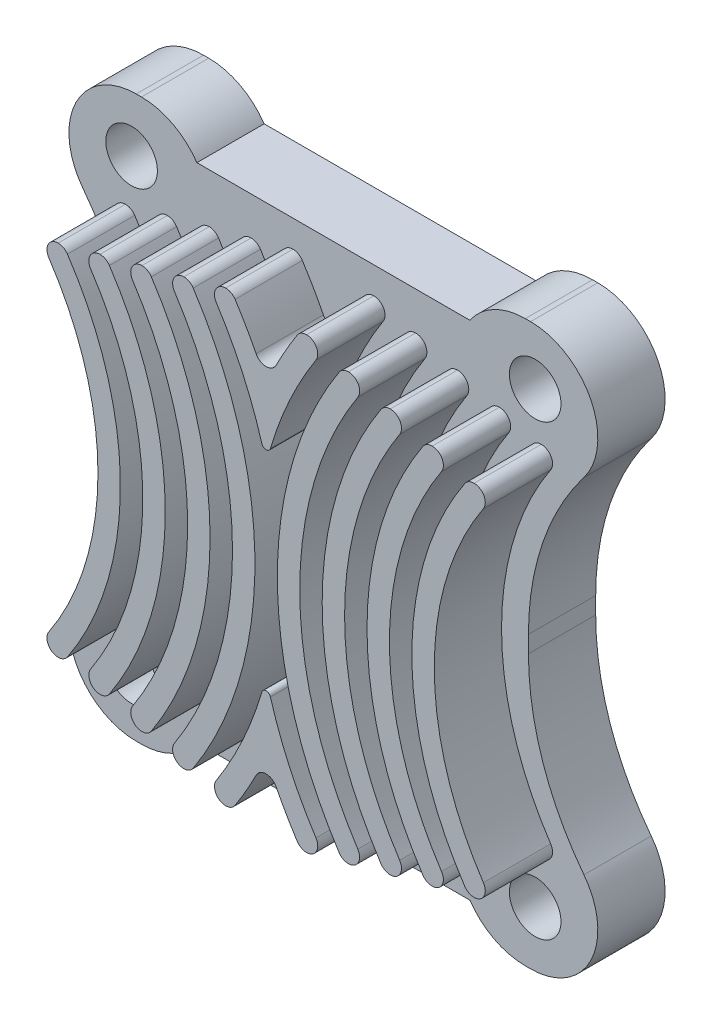
from build123d import *

# Parameters (mm, degrees)
ESQUISSE1_R             = 3.15
ESQUISSE1_R_2           = 1.15
ESQUISSE1_W             = 13.4
ESQUISSE1_H             = 12.4
BOSS_EXTRU_1_DEPTH      = 3
ESQUISSE2_W             = 14
ESQUISSE2_H             = 13
ENL_V_MAT_EXTRU_1_DEPTH = 2
CONG_1_R                = 12
ESQUISSE3_W             = 25
ESQUISSE3_H             = 2
ENL_V_MAT_EXTRU_2_DEPTH = 19.153374342
CONG_2_DEPTH            = 4
BOSS_EXTRU_3_DEPTH      = 3
CONG_4_R                = 0.5
CONG_5_R                = 0.2
SYM_TRIE2_START         = 3
SYM_TRIE2_DEPTH         = 3


with BuildPart() as part:
    # Esquisse1 → Boss.-Extru.1 (new body)
    # profile 1 of 6: a face of its own
    with BuildSketch(Plane.XY):
        with Locations((-9, 10)):
            Circle(ESQUISSE1_R)
        with Locations((-9, 10)):
            Circle(ESQUISSE1_R_2, mode=Mode.SUBTRACT)
    # profile 2 of 6: a face of its own
    with BuildSketch(Plane.XY):
        with BuildLine():
            ThreePointArc((-5.85, 10), (-6.66895946, 7.881332966), (-8.7, 6.864318256))
            Line((-8.7, 6.864318256), (-8.7, -6.864318256))
            ThreePointArc((-8.7, -6.864318256), (-6.66895946, -7.881332966), (-5.85, -10))
            ThreePointArc((-5.85, -10), (-5.909952225, -10.611641029), (-6.087526824, -11.2))
            Line((-6.087526824, -11.2), (6.087526824, -11.2))
            ThreePointArc((6.087526824, -11.2), (6.301939581, -8.374278629), (8.7, -6.864318256))
            Line((8.7, -6.864318256), (8.7, 6.864318256))
            ThreePointArc((8.7, 6.864318256), (6.301939581, 8.374278629), (6.087526824, 11.2))
            Line((6.087526824, 11.2), (-6.087526824, 11.2))
            ThreePointArc((-6.087526824, 11.2), (-5.909952225, 10.611641029), (-5.85, 10))
        make_face()
        Rectangle(ESQUISSE1_W, ESQUISSE1_H, mode=Mode.SUBTRACT)
    # profile 3 of 6: a face of its own
    with BuildSketch(Plane.XY):
        with Locations((9, 10)):
            Circle(ESQUISSE1_R)
        with Locations((9, 10)):
            Circle(ESQUISSE1_R_2, mode=Mode.SUBTRACT)
    # profile 4 of 6: a face of its own
    with BuildSketch(Plane.XY):
        with Locations((9, -10)):
            Circle(ESQUISSE1_R)
        with Locations((9, -10)):
            Circle(ESQUISSE1_R_2, mode=Mode.SUBTRACT)
    # profile 5 of 6: a face of its own
    with BuildSketch(Plane.XY):
        with Locations((-9, -10)):
            Circle(ESQUISSE1_R)
        with Locations((-9, -10)):
            Circle(ESQUISSE1_R_2, mode=Mode.SUBTRACT)
    # profile 6 of 6: a face of its own
    with BuildSketch(Plane.XY):
        Rectangle(ESQUISSE1_W, ESQUISSE1_H)
    extrude(amount=BOSS_EXTRU_1_DEPTH)

    # Esquisse2 → Enlèv. mat.-Extru.1 (cut)
    with BuildSketch(Plane(origin=(0, 0, 0), x_dir=(-1, 0, 0), z_dir=(0, 0, -1))):
        Rectangle(ESQUISSE2_W, ESQUISSE2_H)
    extrude(amount=-ENL_V_MAT_EXTRU_1_DEPTH, mode=Mode.SUBTRACT)

    # Congé1
    cong_1_edges = [part.edges().sort_by_distance(p)[0] for p in [
        (8.7, 6.864318256, 1.5),
        (8.7, -6.864318256, 1.5),
        (-8.7, -6.864318256, 1.5),
        (-8.7, 6.864318256, 1.5),
    ]]
    fillet(cong_1_edges, radius=CONG_1_R)

    # Esquisse3 → Enlèv. mat.-Extru.2 (cut, through all)
    with BuildSketch(Plane.XY.offset(3)):
        with Locations((0, -13.5)):
            Rectangle(ESQUISSE3_W, ESQUISSE3_H)
        with Locations((0, 13.5)):
            Rectangle(ESQUISSE3_W, ESQUISSE3_H)
    extrude(amount=-ENL_V_MAT_EXTRU_2_DEPTH, mode=Mode.SUBTRACT)

    # Congé2: read off the stored shape, not the designer's step
    # Congé2 outline → Congé2 (cut)
    with BuildSketch(Plane.XY):
        with BuildLine():
            ThreePointArc((-11.432673267, 7.998850137), (-11.302722907, 7.838074648), (-11.175561441, 7.675084417))
            ThreePointArc((-11.175561441, 7.675084417), (-11.484688477, 10.827639494), (-8.794451801, 12.5))
            Line((-8.794451801, 12.5), (-10.91637679, 12.5))
            ThreePointArc((-10.91637679, 12.5), (-12.129480248, 10.358961527), (-11.432673267, 7.998850137))
        make_face()
        with BuildLine():
            Line((-7.08362321, 12.5), (-8.559368243, 12.5))
            ThreePointArc((-8.559368243, 12.5), (-7.162944239, 12.155183609), (-6.087526824, 11.2))
            ThreePointArc((-6.087526824, 11.2), (-6.499610431, 11.915868472), (-7.08362321, 12.5))
        make_face()
        with BuildLine():
            Line((10.91637679, 12.5), (8.794451801, 12.5))
            ThreePointArc((8.794451801, 12.5), (11.484688477, 10.827639494), (11.175561441, 7.675084417))
            ThreePointArc((11.175561441, 7.675084417), (11.302722907, 7.838074648), (11.432673267, 7.998850137))
            ThreePointArc((11.432673267, 7.998850137), (12.129480248, 10.358961527), (10.91637679, 12.5))
        make_face()
        with BuildLine():
            ThreePointArc((6.087526824, 11.2), (7.162944239, 12.155183609), (8.559368243, 12.5))
            Line((8.559368243, 12.5), (7.08362321, 12.5))
            ThreePointArc((7.08362321, 12.5), (6.499610431, 11.915868472), (6.087526824, 11.2))
        make_face()
        with BuildLine():
            ThreePointArc((11.432673267, -7.998850137), (11.302722907, -7.838074648), (11.175561441, -7.675084417))
            ThreePointArc((11.175561441, -7.675084417), (11.484688477, -10.827639494), (8.794451801, -12.5))
            Line((8.794451801, -12.5), (10.91637679, -12.5))
            ThreePointArc((10.91637679, -12.5), (12.129480248, -10.358961527), (11.432673267, -7.998850137))
        make_face()
        with BuildLine():
            Line((7.08362321, -12.5), (8.559368243, -12.5))
            ThreePointArc((8.559368243, -12.5), (7.162944239, -12.155183609), (6.087526824, -11.2))
            ThreePointArc((6.087526824, -11.2), (6.499610431, -11.915868472), (7.08362321, -12.5))
        make_face()
        with BuildLine():
            ThreePointArc((-7.08362321, -12.5), (-6.499610431, -11.915868472), (-6.087526824, -11.2))
            ThreePointArc((-6.087526824, -11.2), (-7.162944239, -12.155183609), (-8.559368243, -12.5))
            Line((-8.559368243, -12.5), (-7.08362321, -12.5))
        make_face()
        with BuildLine():
            Line((-10.91637679, -12.5), (-8.794451801, -12.5))
            ThreePointArc((-8.794451801, -12.5), (-11.484688477, -10.827639494), (-11.175561441, -7.675084417))
            ThreePointArc((-11.175561441, -7.675084417), (-11.302722907, -7.838074648), (-11.432673267, -7.998850137))
            ThreePointArc((-11.432673267, -7.998850137), (-12.129480248, -10.358961527), (-10.91637679, -12.5))
        make_face()
    extrude(amount=CONG_2_DEPTH, mode=Mode.SUBTRACT)

    # Esquisse5 → Boss.-Extru.3 (add)
    with BuildSketch(Plane.XY.offset(3)):
        with BuildLine():
            Line((-10.253049234, 8), (-9.010874707, 8))
            ThreePointArc((-9.010874707, 8), (-6.5, 0), (-9.010874707, -8))
            Line((-9.010874707, -8), (-10.253049234, -8))
            ThreePointArc((-10.253049234, -8), (-7.5, 0), (-10.253049234, 8))
        make_face()
        with BuildLine():
            Line((-8.375702269, -8.5), (-7.140792906, -8.5))
            ThreePointArc((-7.140792906, -8.5), (-4.5, 0), (-7.140792906, 8.5))
            Line((-7.140792906, 8.5), (-8.375702269, 8.5))
            ThreePointArc((-8.375702269, 8.5), (-5.5, 0), (-8.375702269, -8.5))
        make_face()
        with BuildLine():
            Line((-6.5, 9), (-5.271243445, 9))
            ThreePointArc((-5.271243445, 9), (-2.5, 0), (-5.271243445, -9))
            Line((-5.271243445, -9), (-6.5, -9))
            ThreePointArc((-6.5, -9), (-3.5, 0), (-6.5, 9))
        make_face()
        with BuildLine():
            Line((-4.62560681, 9.5), (-3.40212782, 9.5))
            ThreePointArc((-3.40212782, 9.5), (-0.5, 0), (-3.40212782, -9.5))
            Line((-3.40212782, -9.5), (-4.62560681, -9.5))
            ThreePointArc((-4.62560681, -9.5), (-1.5, 0), (-4.62560681, 9.5))
        make_face()
        with BuildLine():
            Line((-2.752272915, 10), (-1.533370453, 10))
            ThreePointArc((-1.533370453, 10), (-0.704242426, 8.630993145), (0, 7.193747285))
            ThreePointArc((0, 7.193747285), (0.704242426, 8.630993145), (1.533370453, 10))
            Line((1.533370453, 10), (2.752272915, 10))
            ThreePointArc((2.752272915, 10), (1.090413162, 7.179459136), (0, 4.092676386))
            ThreePointArc((0, 4.092676386), (-1.090413162, 7.179459136), (-2.752272915, 10))
        make_face()
        with BuildLine():
            Line((-2.752272915, -10), (-1.533370453, -10))
            ThreePointArc((-1.533370453, -10), (-0.704242426, -8.630993145), (0, -7.193747285))
            ThreePointArc((0, -7.193747285), (0.704242426, -8.630993145), (1.533370453, -10))
            Line((1.533370453, -10), (2.752272915, -10))
            ThreePointArc((2.752272915, -10), (1.090413162, -7.179459136), (0, -4.092676386))
            ThreePointArc((0, -4.092676386), (-1.090413162, -7.179459136), (-2.752272915, -10))
        make_face()
    extrude(amount=BOSS_EXTRU_3_DEPTH)

    # Congé4
    cong_4_edges = [part.edges().sort_by_distance(p)[0] for p in [
        (2.752272915, 10, 4.5),
        (1.533370453, 10, 4.5),
        (0, 7.193747285, 4.5),
        (-1.533370453, 10, 4.5),
        (-2.752272915, 10, 4.5),
        (-3.40212782, 9.5, 4.5),
        (-4.62560681, 9.5, 4.5),
        (-5.271243445, 9, 4.5),
        (-6.5, 9, 4.5),
        (-7.140792906, 8.5, 4.5),
        (-8.375702269, 8.5, 4.5),
        (-9.010874707, 8, 4.5),
        (-10.253049234, 8, 4.5),
        (0, -7.193747285, 4.5),
        (2.752272915, -10, 4.5),
        (1.533370453, -10, 4.5),
        (-1.533370453, -10, 4.5),
        (-2.752272915, -10, 4.5),
        (-3.40212782, -9.5, 4.5),
        (-4.62560681, -9.5, 4.5),
        (-5.271243445, -9, 4.5),
        (-6.5, -9, 4.5),
        (-7.140792906, -8.5, 4.5),
        (-8.375702269, -8.5, 4.5),
        (-9.010874707, -8, 4.5),
        (-10.253049234, -8, 4.5),
    ]]
    fillet(cong_4_edges, radius=CONG_4_R - 0.0001)  # a hair under: the kernel refuses the full size

    # Congé5
    cong_5_edges = [part.edges().sort_by_distance(p)[0] for p in [
        (0, 4.092676386, 4.5),
        (0, -4.092676386, 4.5),
    ]]
    fillet(cong_5_edges, radius=CONG_5_R)

    # Symétrie2: read off the stored shape, not the designer's step
    # Symétrie2 outline → Symétrie2 (add)
    with BuildSketch(Plane.XY.offset(SYM_TRIE2_START)):
        with BuildLine():
            ThreePointArc((9.27502784, -8), (9.715986392, -7.73570226), (9.690767549, -7.222222222))
            ThreePointArc((9.690767549, -7.222222222), (7.5, 0), (9.690767549, 7.222222222))
            ThreePointArc((9.690767549, 7.222222222), (9.715986392, 7.73570226), (9.27502784, 8))
            ThreePointArc((9.27502784, 8), (9.039325579, 7.940958552), (8.85928813, 7.777777778))
            ThreePointArc((8.85928813, 7.777777778), (6.5, 0), (8.85928813, -7.777777778))
            ThreePointArc((8.85928813, -7.777777778), (9.039325579, -7.940958552), (9.27502784, -8))
        make_face()
        with BuildLine():
            ThreePointArc((7.406613378, -8.5), (7.847028542, -8.236716038), (7.823626709, -7.724137931))
            ThreePointArc((7.823626709, -7.724137931), (5.5, 0), (7.823626709, 7.724137931))
            ThreePointArc((7.823626709, 7.724137931), (7.847028542, 8.236716038), (7.406613378, 8.5))
            ThreePointArc((7.406613378, 8.5), (7.169897339, 8.440415165), (6.989600046, 8.275862069))
            ThreePointArc((6.989600046, 8.275862069), (4.5, 0), (6.989600046, -8.275862069))
            ThreePointArc((6.989600046, -8.275862069), (7.169897339, -8.440415165), (7.406613378, -8.5))
        make_face()
        with BuildLine():
            ThreePointArc((5.538518603, -9), (5.978459948, -8.737595482), (5.956630906, -8.225806452))
            ThreePointArc((5.956630906, -8.225806452), (3.5, 0), (5.956630906, 8.225806452))
            ThreePointArc((5.956630906, 8.225806452), (5.978459948, 8.737595482), (5.538518603, 9))
            ThreePointArc((5.538518603, 9), (5.300923121, 8.939941345), (5.1204063, 8.774193548))
            ThreePointArc((5.1204063, 8.774193548), (2.5, 0), (5.1204063, -8.774193548))
            ThreePointArc((5.1204063, -8.774193548), (5.300923121, -8.939941345), (5.538518603, -9))
        make_face()
        with BuildLine():
            ThreePointArc((3.670683314, -9.5), (4.110207851, -9.238365647), (4.089753517, -8.727272727))
            ThreePointArc((4.089753517, -8.727272727), (1.5, 0), (4.089753517, 8.727272727))
            ThreePointArc((4.089753517, 8.727272727), (4.110207851, 9.238365647), (3.670683314, 9.5))
            ThreePointArc((3.670683314, 9.5), (3.432317667, 9.439524536), (3.251613111, 9.272727273))
            ThreePointArc((3.251613111, 9.272727273), (0.5, 0), (3.251613111, -9.272727273))
            ThreePointArc((3.251613111, -9.272727273), (3.432317667, -9.439524536), (3.670683314, -9.5))
        make_face()
    extrude(amount=SYM_TRIE2_DEPTH)


solid = part.part
